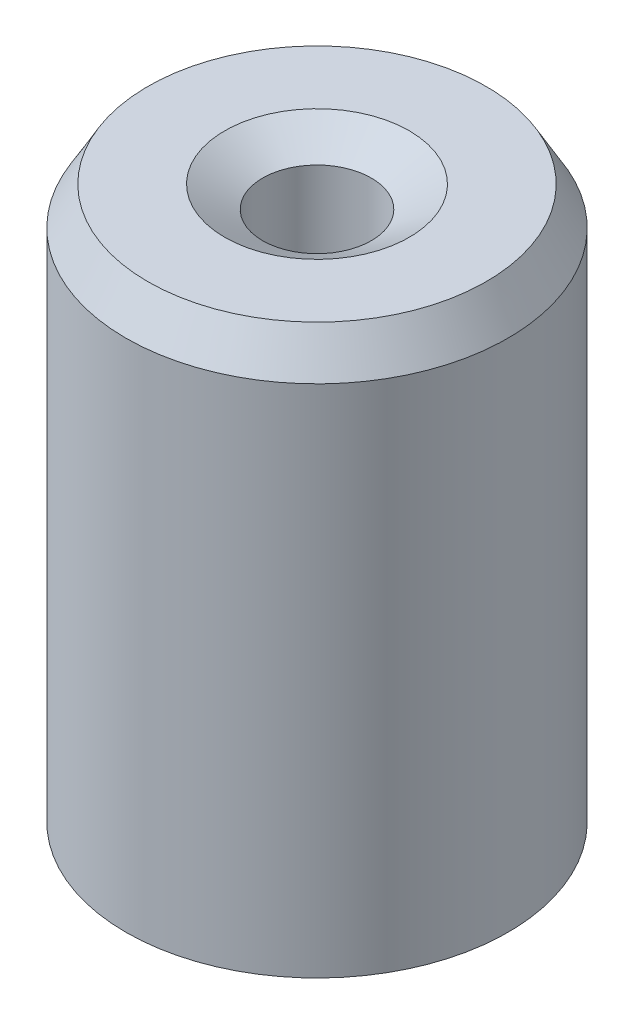
from build123d import *
from OCP.BRepFilletAPI import BRepFilletAPI_MakeChamfer

# Parameters (mm, degrees)
SKETCH1_R           = 5
BOSS_EXTRUDE1_DEPTH = 15.031816656
SKETCH2_R           = 1.42182938
CUT_EXTRUDE1_DEPTH  = 17.61190874
CHAMFER1_SIZE       = 0.993205208
CHAMFER1_SIZE2      = 0.573427294


with BuildPart() as part:
    # Sketch1 → Boss-Extrude1 (new body)
    with BuildSketch(Plane(origin=(0, 0, 0), x_dir=(1, 0, 0), z_dir=(0, 1, 0))):
        Circle(SKETCH1_R)
    extrude(amount=BOSS_EXTRUDE1_DEPTH)

    # Sketch2 → Cut-Extrude1 (cut, through all)
    with BuildSketch(Plane(origin=(0, 0, 0), x_dir=(1, 0, 0), z_dir=(0, 1, 0))):
        Circle(SKETCH2_R)
    extrude(amount=CUT_EXTRUDE1_DEPTH, mode=Mode.SUBTRACT)

    # Chamfer1: one chamfer whose edges measure the first distance from different faces: ONE call of the kernel's chamfer builder (chamfer() names one face for all edges)
    chamfer1_edges_1 = [part.edges().sort_by_distance(p)[0] for p in [
        (-1.42182938, 15.031816656, 0),
    ]]
    chamfer1_side_1 = [part.faces().sort_by_distance(p)[0] for p in [
        (-4.858578644, 15.031816656, 0),
    ]]
    chamfer1_edges_2 = [part.edges().sort_by_distance(p)[0] for p in [
        (-1.42182938, 0, 0),
    ]]
    chamfer1_side_2 = [part.faces().sort_by_distance(p)[0] for p in [
        (-1.42182938, 7.515908328, 0),
    ]]
    chamfer1_edges_3 = [part.edges().sort_by_distance(p)[0] for p in [
        (-5, 0, 0),
    ]]
    chamfer1_side_3 = [part.faces().sort_by_distance(p)[0] for p in [
        (-4.858578644, 0, 0),
    ]]
    chamfer1_edges_4 = [part.edges().sort_by_distance(p)[0] for p in [
        (-5, 15.031816656, 0),
    ]]
    chamfer1_side_4 = [part.faces().sort_by_distance(p)[0] for p in [
        (-5, 7.515908328, 0),
    ]]
    chamfer1 = BRepFilletAPI_MakeChamfer(part.part.solid().wrapped)
    for e in chamfer1_edges_1:
        chamfer1.Add(CHAMFER1_SIZE, CHAMFER1_SIZE2, e.wrapped, chamfer1_side_1[0].wrapped)  # the first distance lies on this face
    for e in chamfer1_edges_2:
        chamfer1.Add(CHAMFER1_SIZE, CHAMFER1_SIZE2, e.wrapped, chamfer1_side_2[0].wrapped)  # the first distance lies on this face
    for e in chamfer1_edges_3:
        chamfer1.Add(CHAMFER1_SIZE, CHAMFER1_SIZE2, e.wrapped, chamfer1_side_3[0].wrapped)  # the first distance lies on this face
    for e in chamfer1_edges_4:
        chamfer1.Add(CHAMFER1_SIZE, CHAMFER1_SIZE2, e.wrapped, chamfer1_side_4[0].wrapped)  # the first distance lies on this face
    add(Compound.cast(chamfer1.Shape()), mode=Mode.REPLACE)


solid = part.part
